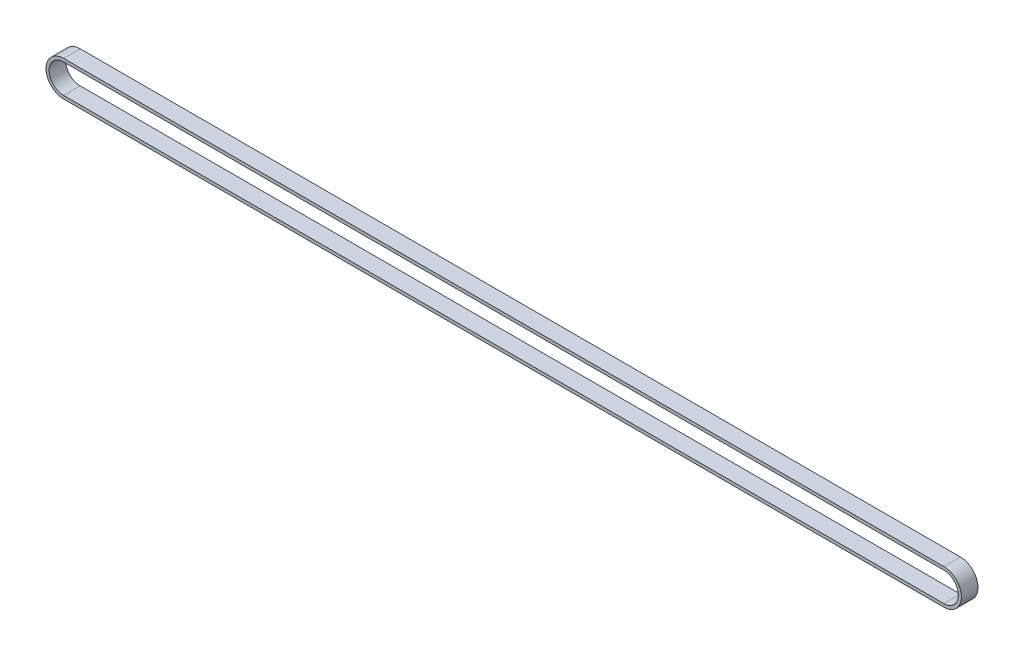
from build123d import *

# Parameters (mm, degrees)
ESTRUSIONE_ESTRUSIONE1_DEPTH = 6.4


with BuildPart() as part:
    # Schizzo1 → Estrusione-Estrusione1 (new body)
    with BuildSketch(Plane.XY):
        with BuildLine():
            Line((0, -6.8), (-340, -6.8))
            ThreePointArc((-340, -6.8), (-346.8, 0), (-340, 6.8))
            Line((-340, 6.8), (0, 6.8))
            ThreePointArc((0, 6.8), (6.8, 0), (0, -6.8))
        make_face()
        with BuildLine():
            Line((0, -5.6), (-340, -5.6))
            ThreePointArc((-340, -5.6), (-345.6, 0), (-340, 5.6))
            Line((-340, 5.6), (0, 5.6))
            ThreePointArc((0, 5.6), (5.6, 0), (0, -5.6))
        make_face(mode=Mode.SUBTRACT)
    extrude(amount=ESTRUSIONE_ESTRUSIONE1_DEPTH)


solid = part.part
